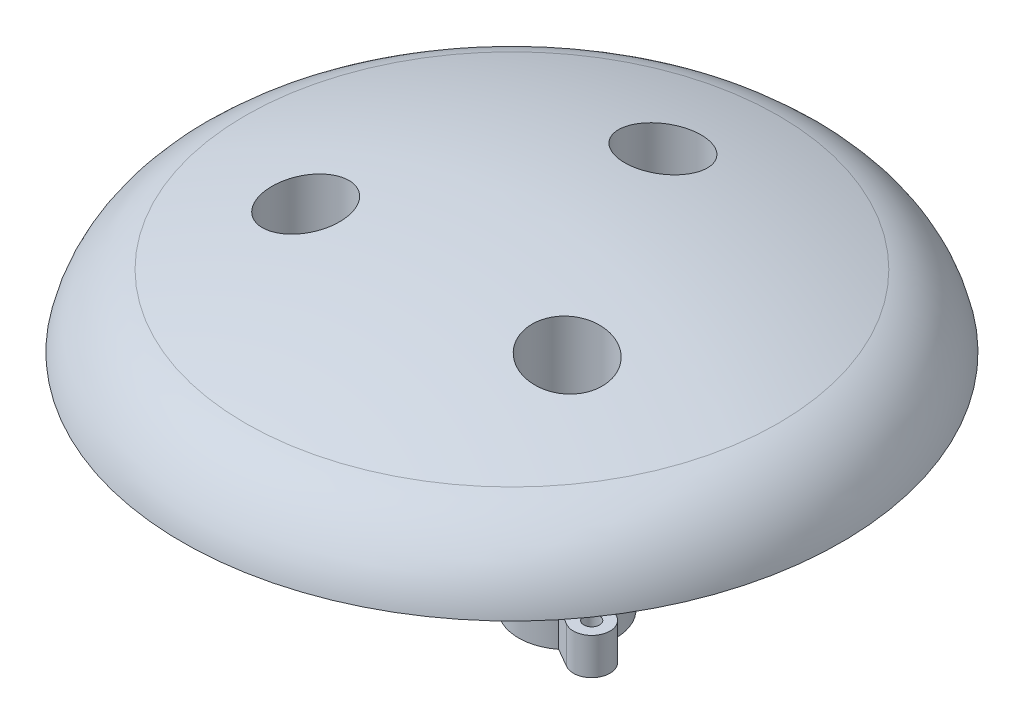
from build123d import *

# Parameters (mm, degrees)
SALIENTE_EXTRUIR2_REACH = 220.943
SALIENTE_EXTRUIR2_START = 85
CROQUIS5_R              = 50
SALIENTE_EXTRUIR1_START = 55
CROQUIS1_R              = 9.3
CROQUIS1_R_2            = 7.3
SALIENTE_EXTRUIR1_DEPTH = 37
CROQUIS3_R              = 7.3
CORTAR_EXTRUIR1_DEPTH   = 134.943322251
CROQUIS12_R             = 1.5
SALIENTE_EXTRUIR6_DEPTH = 7
CORTAR_EXTRUIR4_DEPTH   = 25
MATRIZC1_COUNT          = 3
REDONDEO2_R             = 5
REDONDEO3_R             = 7


with BuildPart() as part:
    # Croquis2 → Revolución1 (revolve)
    with BuildSketch(Plane.XY, mode=Mode.PRIVATE) as revoluci_n1_sk:
        with BuildLine():
            Line((0, 100), (0, 97))
            ThreePointArc((0, 97), (25.331916962, 94.942873289), (50, 88.825401058))
            ThreePointArc((50, 88.825401058), (56.566822084, 84.464907665), (60.070059752, 77.403436094))
            Line((60.070059752, 77.403436094), (63.011163994, 77.994964485))
            ThreePointArc((63.011163994, 77.994964485), (58.817131536, 86.448870207), (50.955414013, 91.66919853))
            ThreePointArc((50.955414013, 91.66919853), (25.815966331, 97.903565135), (0, 100))
        make_face()
    revolve(revoluci_n1_sk.sketch.rotate(Axis((0, 0, 0), (0, 1, 0)), 90), axis=Axis((0, 0, 0), (0, 1, 0)))

    # Croquis5 → Saliente-Extruir2 (add, up to next)
    with BuildSketch(Plane(origin=(0, 0, 0), x_dir=(1, 0, 0), z_dir=(0, 1, 0)).offset(SALIENTE_EXTRUIR2_START), mode=Mode.PRIVATE) as saliente_extruir2_sk1:
        with Locations(Location((0, 0, 0), (0, 0, 90))):
            Circle(CROQUIS5_R)
    saliente_extruir2_tool1 = extrude(saliente_extruir2_sk1.sketch, amount=SALIENTE_EXTRUIR2_REACH, mode=Mode.PRIVATE) - part.part
    add(saliente_extruir2_tool1.solids().sort_by_distance((0, 85, 0))[0])

    # Croquis1 → Saliente-Extruir1 (add)
    # profile 1 of 3: a face of its own
    with BuildSketch(Plane(origin=(0, 0, 0), x_dir=(1, 0, 0), z_dir=(0, 1, 0)).offset(SALIENTE_EXTRUIR1_START)):
        with Locations(Location((0, 28.867513459, 0), (0, 0, 270))):
            Circle(CROQUIS1_R)
        with Locations(Location((0, 28.867513459, 0), (0, 0, 270))):
            Circle(CROQUIS1_R_2, mode=Mode.SUBTRACT)
    # profile 2 of 3: a face of its own
    with BuildSketch(Plane(origin=(0, 0, 0), x_dir=(1, 0, 0), z_dir=(0, 1, 0)).offset(SALIENTE_EXTRUIR1_START)):
        with Locations(Location((25, -14.43375673, 0), (0, 0, 270))):
            Circle(CROQUIS1_R)
        with Locations(Location((25, -14.43375673, 0), (0, 0, 270))):
            Circle(CROQUIS1_R_2, mode=Mode.SUBTRACT)
    # profile 3 of 3: a face of its own
    with BuildSketch(Plane(origin=(0, 0, 0), x_dir=(1, 0, 0), z_dir=(0, 1, 0)).offset(SALIENTE_EXTRUIR1_START)):
        with Locations(Location((-25, -14.43375673, 0), (0, 0, 270))):
            Circle(CROQUIS1_R)
        with Locations(Location((-25, -14.43375673, 0), (0, 0, 270))):
            Circle(CROQUIS1_R_2, mode=Mode.SUBTRACT)
    extrude(amount=SALIENTE_EXTRUIR1_DEPTH)

    # Croquis3 → Cortar-Extruir1 (cut, through all)
    with BuildSketch(Plane(origin=(0, 0, 0), x_dir=(1, 0, 0), z_dir=(0, 1, 0))):
        with Locations(Location((25, -14.43375673, 0), (0, 0, 134.786535958))):
            Circle(CROQUIS3_R)
        with Locations(Location((0, 28.867513459, 0), (0, 0, 132.389969071))):
            Circle(CROQUIS3_R)
        with Locations(Location((-25, -14.43375673, 0), (0, 0, 133.577494884))):
            Circle(CROQUIS3_R)
    extrude(amount=CORTAR_EXTRUIR1_DEPTH, mode=Mode.SUBTRACT)

    # Croquis12 → Saliente-Extruir6 (add)
    with BuildSketch(Plane.XZ.offset(-55)):
        with BuildLine():
            Line((-37.835125168, 17.802667816), (-34.211903242, 15.710799662))
            ThreePointArc((-34.211903242, 15.710799662), (-33.054036255, 19.08375673), (-30.711903242, 21.772977489))
            Line((-30.711903242, 21.772977489), (-34.335125168, 23.864845643))
            ThreePointArc((-34.335125168, 23.864845643), (-39.116214082, 22.58375673), (-37.835125168, 17.802667816))
        make_face()
        with Locations(Location((-36.085125168, 20.83375673, 0), (0, 0, 270))):
            Circle(CROQUIS12_R, mode=Mode.SUBTRACT)
    saliente_extruir6 = extrude(amount=-SALIENTE_EXTRUIR6_DEPTH)

    # Croquis10 → Cortar-Extruir4 (cut)
    with BuildSketch(Plane.XY):
        with BuildLine():
            Line((-5, 47), (-5, 70))
            ThreePointArc((-5, 70), (0, 75), (5, 70))
            Line((5, 70), (5, 47))
            ThreePointArc((5, 47), (0, 42), (-5, 47))
        make_face()
    cortar_extruir4 = extrude(amount=-CORTAR_EXTRUIR4_DEPTH, mode=Mode.SUBTRACT)

    # MatrizC1: Saliente-Extruir6, Cortar-Extruir4 ×3 about axis
    matrizc1_axis = Axis((0, 0, 0), (0, 1, 0))
    add([saliente_extruir6.rotate(matrizc1_axis, i * 360 / MATRIZC1_COUNT) for i in range(1, MATRIZC1_COUNT)])
    add([cortar_extruir4.rotate(matrizc1_axis, i * 360 / MATRIZC1_COUNT) for i in range(1, MATRIZC1_COUNT)], mode=Mode.SUBTRACT)

    # Redondeo2
    redondeo2_edges = [part.edges().sort_by_distance(p)[0] for p in [
        (0, 85, -38.167513459),
        (25, 85, 5.13375673),
        (-25, 85, 5.13375673),
    ]]
    fillet(redondeo2_edges, radius=REDONDEO2_R)

    # Redondeo3
    # the kernel refuses this fillet: 7 mm, written as the material it takes off along each edge
    with BuildSketch(Plane(origin=(0, 85, 0), x_dir=(0, 0, -1), z_dir=(1, 0, 0))) as redondeo3_piece_1:
        with BuildLine():
            CenterArc((43.761256412, 7), REDONDEO3_R, 270, 63.030628279)
            Line((50, 3.825401058), (50.124774872, 3.761909079))
            ThreePointArc((50.124774872, 3.761909079), (50.14, 1.912700529), (50.14, 0))
            Line((50.14, 0), (50, -0.14))
            Line((50, -0.14), (43.761256412, -0.14))
            Line((43.761256412, -0.14), (43.761256412, 0))
        make_face()
    revolve(axis=Axis((0, 85, 0), (0, 1, 0)), mode=Mode.SUBTRACT)


solid = part.part
